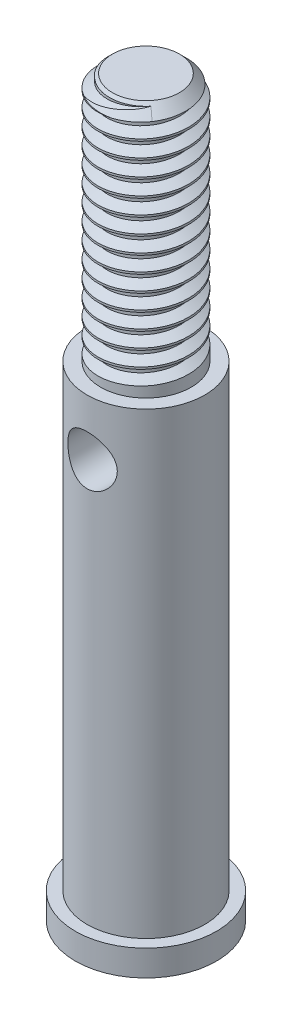
from build123d import *

# Parameters (mm, degrees)
SKETCH1_R           = 3
BOSS_EXTRUDE1_DEPTH = 1.1
SKETCH2_R           = 2.5
BOSS_EXTRUDE2_DEPTH = 19.5
SKETCH3_R           = 1.925
BOSS_EXTRUDE3_DEPTH = 10.6
CHAMFER1_SIZE       = 0.5
THREAD1_PITCH       = 0.7
CUT_EXTRUDE1_REACH  = 33.823
SKETCH8_R           = 1.05


with BuildPart() as part:
    # Sketch1 → Boss-Extrude1 (new body)
    with BuildSketch(Plane(origin=(0, 0, 0), x_dir=(1, 0, 0), z_dir=(0, 1, 0))):
        with Locations(Location((0, 0, 0), (0, 0, 270))):
            Circle(SKETCH1_R)
    extrude(amount=BOSS_EXTRUDE1_DEPTH)

    # Sketch2 → Boss-Extrude2 (add)
    with BuildSketch(Plane(origin=(0, 1.1, 0), x_dir=(1, 0, 0), z_dir=(0, 1, 0))):
        with Locations(Location((0, 0, 0), (0, 0, 270))):
            Circle(SKETCH2_R)
    extrude(amount=BOSS_EXTRUDE2_DEPTH)

    # Sketch3 → Boss-Extrude3 (add)
    with BuildSketch(Plane(origin=(0, 20.6, 0), x_dir=(1, 0, 0), z_dir=(0, 1, 0))):
        with Locations(Location((0, 0, 0), (0, 0, 270))):
            Circle(SKETCH3_R)
    extrude(amount=BOSS_EXTRUDE3_DEPTH)

    # Chamfer1
    chamfer1_edges = [part.edges().sort_by_distance(p)[0] for p in [
        (0, 31.2, -1.925),
    ]]
    chamfer(chamfer1_edges, length=CHAMFER1_SIZE)

    # Thread1: the profile of Thread Profile1 profile screwed along a right-hand helix of 15.142857 turns, 6 arcs to a turn; built about Z, then put on its axis
    thread1_z = Axis((0, 0, 0), (0, 0, 1))
    thread1_corners = [(1.9253, 0, -0.000173205), (1.9253, 0, 0.612673203), (1.546113888, 0, 0.393749999), (1.546113888, 0, 0.218749999)]
    with BuildLine(mode=Mode.PRIVATE) as thread1_profile:
        Line(thread1_corners[0], thread1_corners[1])
        Line(thread1_corners[1], thread1_corners[2])
        Line(thread1_corners[2], thread1_corners[3])
        Line(thread1_corners[3], thread1_corners[0])
    thread1_cap = Face(thread1_profile.wire())
    thread1_turn_angles = [0, 30, 60, 90, 120, 150, 180, 210, 240, 270, 300, 330, 360]
    thread1_turn_weights = [1, 0.8660254037844387, 1, 0.8660254037844387, 1, 0.8660254037844387, 1, 0.8660254037844387, 1, 0.8660254037844387, 1, 0.8660254037844387, 1]
    thread1_turn_rails = [Edge.make_bspline([Vector(p[0], p[1], 0).rotate(thread1_z, thread1_turn_angles[k]) / thread1_turn_weights[k] + Vector(0, 0, p[2] + THREAD1_PITCH * thread1_turn_angles[k] / 360) for k in range(13)], [0, 0, 0, 1, 1, 2, 2, 3, 3, 4, 4, 5, 5, 6, 6, 6], 2, thread1_turn_weights) for p in thread1_corners]
    thread1_turn_sides = [Face.make_surface_from_curves(thread1_turn_rails[p[0]], thread1_turn_rails[p[1]]) for p in [(0, 1), (1, 2), (2, 3), (3, 0)]]
    thread1_turn = Solid(Shell([*thread1_turn_sides, thread1_cap, thread1_cap.rotate(thread1_z, 360).moved(Location((0, 0, THREAD1_PITCH * 360 / 360)))]))
    thread1_last_angles = [5400, 5425.714285714, 5451.428571429]
    thread1_last_weights = [1, 0.900968867902422, 1]
    thread1_last_rails = [Edge.make_bspline([Vector(p[0], p[1], 0).rotate(thread1_z, thread1_last_angles[k]) / thread1_last_weights[k] + Vector(0, 0, p[2] + THREAD1_PITCH * thread1_last_angles[k] / 360) for k in range(3)], [0, 0, 0, 1, 1, 1], 2, thread1_last_weights) for p in thread1_corners]
    thread1_last_sides = [Face.make_surface_from_curves(thread1_last_rails[p[0]], thread1_last_rails[p[1]]) for p in [(0, 1), (1, 2), (2, 3), (3, 0)]]
    thread1_last = Solid(Shell([*thread1_last_sides, thread1_cap.rotate(thread1_z, 5400).moved(Location((0, 0, THREAD1_PITCH * 5400 / 360))), thread1_cap.rotate(thread1_z, 5451.428571429).moved(Location((0, 0, THREAD1_PITCH * 5451.428571429 / 360)))]))
    thread1_each = [*[thread1_turn.moved(Location((0, 0, THREAD1_PITCH * i))) for i in range(15)], thread1_last]
    add(Plane(origin=(0, 31.9, 0), x_dir=(-1, 0, 0), z_dir=(0, -1, 0)) * Compound([thread1_each[i] for i in range(0, 16, 2)]), mode=Mode.SUBTRACT)
    add(Plane(origin=(0, 31.9, 0), x_dir=(-1, 0, 0), z_dir=(0, -1, 0)) * Compound([thread1_each[i] for i in range(1, 16, 2)]), mode=Mode.SUBTRACT)

    # Sketch8 → Cut-Extrude1 (cut, up to next)
    with BuildSketch(Plane.XY.offset(2.5), mode=Mode.PRIVATE) as cut_extrude1_sk1:
        with Locations((0, 18.2)):
            Circle(SKETCH8_R)
    cut_extrude1_tool1 = extrude(cut_extrude1_sk1.sketch, amount=-CUT_EXTRUDE1_REACH, mode=Mode.PRIVATE) & part.part
    add(cut_extrude1_tool1.solids().sort_by_distance((0, 18.2, 2.5))[0], mode=Mode.SUBTRACT)


solid = part.part
